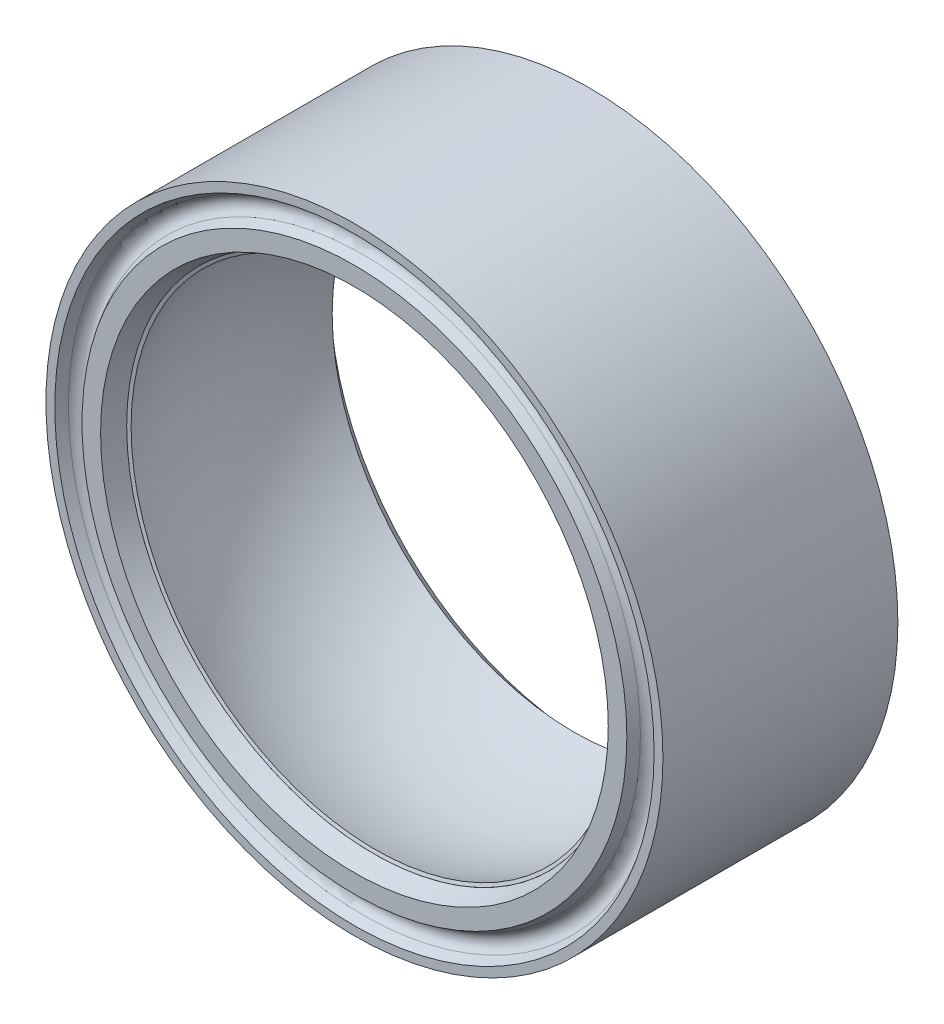
from build123d import *

# Parameters (mm, degrees)
SKETCH1_R           = 11.5062
BOSS_EXTRUDE1_DEPTH = 4.3815
CHAMFER2_SIZE       = 0.569130791
CHAMFER2_SIZE_2     = 0.762


with BuildPart() as part:
    # Sketch1 → Boss-Extrude1 (new, symmetric)
    with BuildSketch(Plane.XY):
        Circle(SKETCH1_R)
    extrude(amount=BOSS_EXTRUDE1_DEPTH, both=True)

    # Sketch2 → Cut-Revolve1 (revolve, cut)
    with BuildSketch(Plane.XY):
        with BuildLine():
            Line((-9.9187, 0), (9.9187, 0))
            ThreePointArc((9.9187, 0), (0, 9.9187), (-9.9187, 0))
        make_face()
    revolve(axis=Axis((-4.998884826, 0, 0), (1, 0, 0)), mode=Mode.SUBTRACT)

    # Chamfer2
    # the kernel refuses this chamfer: 0.762, 0.569130791 mm, written as the material it takes off along each edge
    with BuildSketch(Plane(origin=(0, 0, 4.3815), x_dir=(0, -1, 0), z_dir=(-1, 0, 0))) as chamfer2_piece_1:
        with BuildLine():
            Line((8.898486806 + CHAMFER2_SIZE, 0), (9.220604444, -0.726221164))
            ThreePointArc((9.220604444, -0.726221164), (9.071362926, -0.370143079), (8.898486806, 0))
            Line((8.898486806, 0), (8.898486806 + CHAMFER2_SIZE, 0))
        make_face()
    revolve(axis=Axis((0, 0, 4.3815), (0, 0, 1)), mode=Mode.SUBTRACT)
    with BuildSketch(Plane(origin=(0, 0, -4.3815), x_dir=(0, -1, 0), z_dir=(-1, 0, 0))) as chamfer2_piece_2:
        with BuildLine():
            Line((8.898486806 + CHAMFER2_SIZE_2, 0), (9.137445344, 0.523041463))
            ThreePointArc((9.137445344, 0.523041463), (9.023972412, 0.264640567), (8.898486806, 0))
            Line((8.898486806, 0), (8.898486806 + CHAMFER2_SIZE_2, 0))
        make_face()
    revolve(axis=Axis((0, 0, -4.3815), (0, 0, 1)), mode=Mode.SUBTRACT)

    # Sketch6 → Cut-Revolve9 (revolve, cut)
    with BuildSketch(Plane(origin=(0, 0, 0), x_dir=(0, 0, -1), z_dir=(1, 0, 0)), mode=Mode.PRIVATE) as cut_revolve9_sk:
        with BuildLine():
            Line((4.3815, 11.176), (4.05892, 10.993067091))
            ThreePointArc((4.05892, 10.993067091), (3.869564146, 10.668), (4.05892, 10.342932909))
            Line((4.05892, 10.342932909), (4.3815, 10.16))
            Line((4.3815, 10.16), (4.3815, 11.176))
        make_face()
    cut_revolve9 = revolve(cut_revolve9_sk.sketch.rotate(Axis((0, 0, 0), (0, 0, -1)), 90), axis=Axis((0, 0, 0), (0, 0, -1)), mode=Mode.SUBTRACT)

    # Mirror1: Cut-Revolve9 across plane
    add(cut_revolve9.mirror(Plane.XY), mode=Mode.SUBTRACT)


with BuildPart() as body_2:
    # Thicken1: read off the stored shape, not the designer's step
    # Thicken1 outline → Thicken1 (revolve)
    with BuildSketch(Plane.XZ):
        with BuildLine():
            Line((9.220604443, 3.655278841), (9.102542924, 3.608476299))
            ThreePointArc((9.102542924, 3.608476299), (9.791100353, -0.108364062), (9.0204486, -3.809054468))
            Line((9.0204486, -3.809054468), (9.137445342, -3.858458541))
            ThreePointArc((9.137445342, -3.858458541), (9.918092575, -0.109769562), (9.220604443, 3.655278841))
        make_face()
    revolve(axis=Axis((0, 0, 0), (0, 0, 1)))


solid = Compound([part.part, body_2.part])
